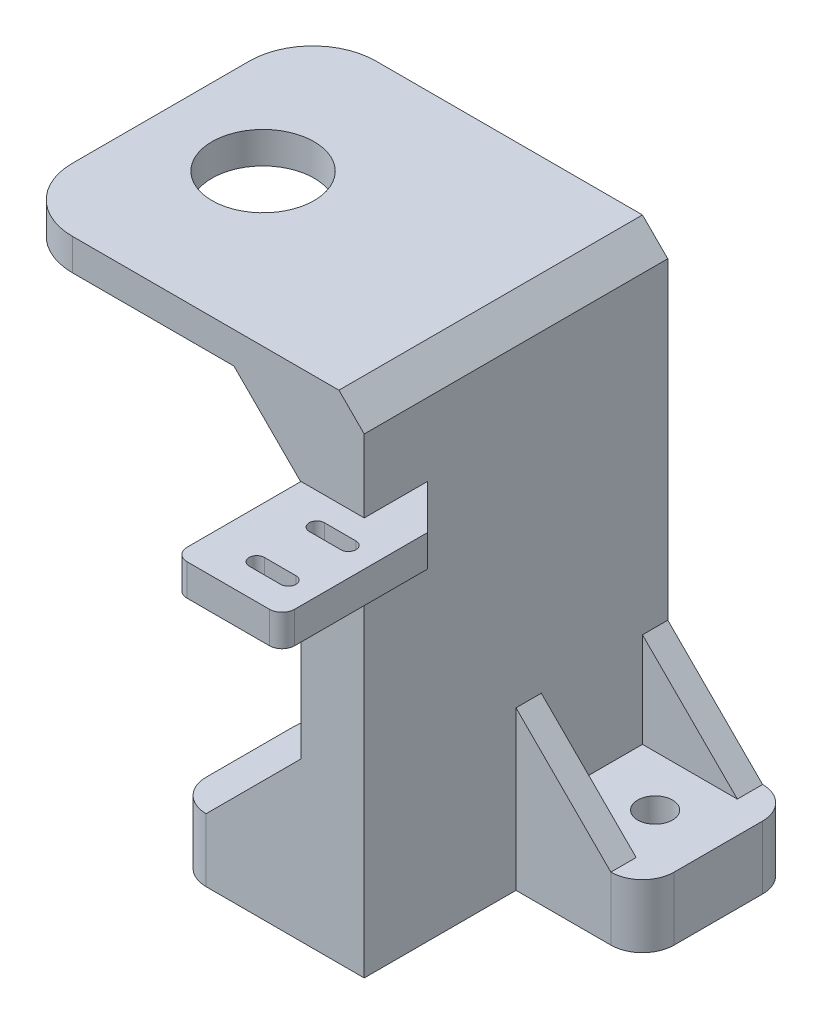
from build123d import *

# Parameters (mm, degrees)
SKETCH1_W                 = 56.15
SKETCH1_H                 = 48
BOSS_EXTRUDE1_DEPTH       = 5
SKETCH2_W                 = 10
SKETCH2_H                 = 48
BOSS_EXTRUDE2_DEPTH       = 73.5
SKETCH3_W                 = 24
SKETCH3_H                 = 10
BOSS_EXTRUDE3_DEPTH       = 20
SKETCH19_W                = 24
SKETCH19_H                = 10
BOSS_EXTRUDE5_DEPTH       = 20
FILLET1_R                 = 10
F_1_0MM_DOWEL_HOLE1_D     = 5.5
F_1_0MM_DOWEL_HOLE1_DEPTH = 10
FILLET2_R                 = 5
M6_CLEARANCE_HOLE1_D      = 16.15
CHAMFER2_SIZE             = 4
SKETCH14_W                = 17
SKETCH14_H                = 5
BOSS_EXTRUDE4_DEPTH       = 20
CHAMFER3_SIZE             = 10
FILLET3_R                 = 2
M2_START                  = -15.5
M2_CLEARANCE_SLOT1_DEPTH  = 5
RIB1_REACH                = 114.898
SKETCH20_WALL_W           = 249.008442536
SKETCH20_WALL_H           = 4
RIB2_REACH                = 104.107
SKETCH21_WALL_W           = 227.427527126
SKETCH21_WALL_H           = 4
RIB10_REACH               = 104.107
SKETCH23_WALL_W           = 221.21432369
SKETCH23_WALL_H           = 4


# Read off the part's stored shape, not the designer's step: M2 Clearance Slot1
with BuildPart() as part:
    # Sketch1 → Boss-Extrude1 (new body)
    with BuildSketch(Plane(origin=(0, 0, 0), x_dir=(1, 0, 0), z_dir=(0, 1, 0))):
        with Locations((4.075, 0)):
            Rectangle(SKETCH1_W, SKETCH1_H)
    extrude(amount=BOSS_EXTRUDE1_DEPTH)

    # Sketch2 → Boss-Extrude2 (add)
    with BuildSketch(Plane.XZ):
        with Locations((27.15, 0)):
            Rectangle(SKETCH2_W, SKETCH2_H)
    extrude(amount=BOSS_EXTRUDE2_DEPTH)

    # Sketch3 → Boss-Extrude3 (add)
    with BuildSketch(Plane(origin=(32.15, 0, 0), x_dir=(0, 0, -1), z_dir=(1, 0, 0))):
        with Locations((12, -68.5)):
            Rectangle(SKETCH3_W, SKETCH3_H)
    extrude(amount=BOSS_EXTRUDE3_DEPTH)

    # Sketch19 → Boss-Extrude5 (add)
    with BuildSketch(Plane(origin=(22.15, 0, -25.5), x_dir=(0, 0, 1), z_dir=(-1, 0, 0))):
        with Locations((37.5, -68.5)):
            Rectangle(SKETCH19_W, SKETCH19_H)
    extrude(amount=BOSS_EXTRUDE5_DEPTH)

    # Fillet1
    fillet1_edges = [part.edges().sort_by_distance(p)[0] for p in [
        (-24, 2.5, -24),
        (-24, 2.5, 24),
    ]]
    fillet(fillet1_edges, radius=FILLET1_R)

    # Ø1.0mm Dowel Hole1
    with Locations(Plane(origin=(0, -63.5, 0), x_dir=(1, 0, 0), z_dir=(0, 1, 0))):
        with Locations((42.15, 12), (12.15, -12)):
            Hole(F_1_0MM_DOWEL_HOLE1_D / 2, depth=F_1_0MM_DOWEL_HOLE1_DEPTH)

    # Fillet2
    fillet2_edges = [part.edges().sort_by_distance(p)[0] for p in [
        (52.15, -68.5, 0),
        (52.15, -68.5, -24),
        (2.15, -68.5, 0),
        (2.15, -68.5, 24),
    ]]
    fillet(fillet2_edges, radius=FILLET2_R)

    # M6 Clearance Hole1 (through all)
    with Locations(Plane(origin=(0, 5, 0), x_dir=(1, 0, 0), z_dir=(0, 1, 0))):
        with Locations((-7.85, 0)):
            Hole(M6_CLEARANCE_HOLE1_D / 2)

    # Chamfer2
    chamfer2_edges = [part.edges().sort_by_distance(p)[0] for p in [
        (32.15, 5, 0),
    ]]
    chamfer(chamfer2_edges, length=CHAMFER2_SIZE)

    # Sketch14 → Boss-Extrude4 (add)
    with BuildSketch(Plane.XY.offset(24)):
        with Locations((30.65, -13)):
            Rectangle(SKETCH14_W, SKETCH14_H)
    extrude(amount=BOSS_EXTRUDE4_DEPTH)

    # Chamfer3
    # the kernel refuses this chamfer: 10 mm, written as the material it adds along each edge
    with BuildSketch(Plane(origin=(32.15, -10.5, 24), x_dir=(-0.027495876610586317, 0, -0.9996219169112968), z_dir=(0, -1, 0))) as chamfer3_piece_1_section:
        Polygon((CHAMFER3_SIZE * 0.999621916911, CHAMFER3_SIZE * 0.0274958766106), (-CHAMFER3_SIZE * 0.0274958766106, CHAMFER3_SIZE * 0.999621916911), (0, 0), align=None)
    chamfer3_piece_1 = extrude(amount=5, mode=Mode.PRIVATE)
    chamfer3_piece_1 = split(chamfer3_piece_1, bisect_by=Plane(origin=(39.15, -13, 20.435897436), z_dir=(-1, 0, 0)), keep=Keep.TOP, mode=Mode.PRIVATE)
    add(chamfer3_piece_1)

    # Fillet3
    fillet3_edges = [part.edges().sort_by_distance(p)[0] for p in [
        (27.15, -15.5, 24),
        (22.15, -13, 44),
        (39.15, -13, 44),
        (32.15, -15.5, 19),
    ]]
    fillet(fillet3_edges, radius=FILLET3_R)

    # M2 Clearance Slot1 outline → M2 Clearance Slot1 (cut)
    with BuildSketch(Plane(origin=(0, 0, 0), x_dir=(1, 0, 0), z_dir=(0, 1, 0)).offset(M2_START)):
        with BuildLine():
            Line((34.65, -27.8), (29.65, -27.8))
            ThreePointArc((29.65, -27.8), (28.45, -29), (29.65, -30.2))
            Line((29.65, -30.2), (34.65, -30.2))
            ThreePointArc((34.65, -30.2), (35.85, -29), (34.65, -27.8))
        make_face()
        with BuildLine():
            Line((34.65, -37.3), (29.65, -37.3))
            ThreePointArc((29.65, -37.3), (28.45, -38.5), (29.65, -39.7))
            Line((29.65, -39.7), (34.65, -39.7))
            ThreePointArc((34.65, -39.7), (35.85, -38.5), (34.65, -37.3))
        make_face()
    extrude(amount=M2_CLEARANCE_SLOT1_DEPTH, mode=Mode.SUBTRACT)

    # Sketch20 wall → Rib1 (add, up to next)
    with BuildSketch(Plane(origin=(39.65, -56, -24), x_dir=(-0.707106781187, 0.707106781187, 0), z_dir=(0.707106781187, 0.707106781187, 0)), mode=Mode.PRIVATE) as rib1_sk1:
        with Locations((0, 2)):
            Rectangle(SKETCH20_WALL_W, SKETCH20_WALL_H)
    rib1_tool1 = extrude(rib1_sk1.sketch, amount=-RIB1_REACH, mode=Mode.PRIVATE) - part.part
    rib1 = rib1_tool1.solids().sort_by_distance((39.65, -56, -24))[0]
    add(rib1)

    # Sketch21 wall → Rib2 (add, up to next)
    with BuildSketch(Plane(origin=(14.65, -56, 24), x_dir=(0.707106781187, 0.707106781187, 0), z_dir=(-0.707106781187, 0.707106781187, 0)), mode=Mode.PRIVATE) as rib2_sk1:
        with Locations((0, 2)):
            Rectangle(SKETCH21_WALL_W, SKETCH21_WALL_H)
    rib2_tool1 = extrude(rib2_sk1.sketch, amount=-RIB2_REACH, mode=Mode.PRIVATE) - part.part
    rib2 = rib2_tool1.solids().sort_by_distance((14.65, -56, 24))[0]
    add(rib2)

    # Sketch23 wall → Rib10 (add, up to next)
    with BuildSketch(Plane(origin=(16.846699141, -5.303300859, 24), x_dir=(-0.707106781187, 0.707106781187, 0), z_dir=(-0.707106781187, -0.707106781187, 0)), mode=Mode.PRIVATE) as rib10_sk1:
        with Locations((0, 2)):
            Rectangle(SKETCH23_WALL_W, SKETCH23_WALL_H)
    rib10_tool1 = extrude(rib10_sk1.sketch, amount=-RIB10_REACH, mode=Mode.PRIVATE) - part.part
    rib10 = rib10_tool1.solids().sort_by_distance((16.846699141, -5.303300859, 24))[0]
    add(rib10)

    # Mirror1: Rib2 across plane
    add(rib2.mirror(Plane(origin=(2.15, -63.5, 12), x_dir=(1, 0, 0), z_dir=(0, 0, 1))))

    # Mirror2: Rib1 across plane
    add(rib1.mirror(Plane(origin=(52.15, -63.5, -12), x_dir=(1, 0, 0), z_dir=(0, 0, -1))))

    # Mirror3: Rib10 across plane
    add(rib10.mirror(Plane.XY))


solid = part.part
